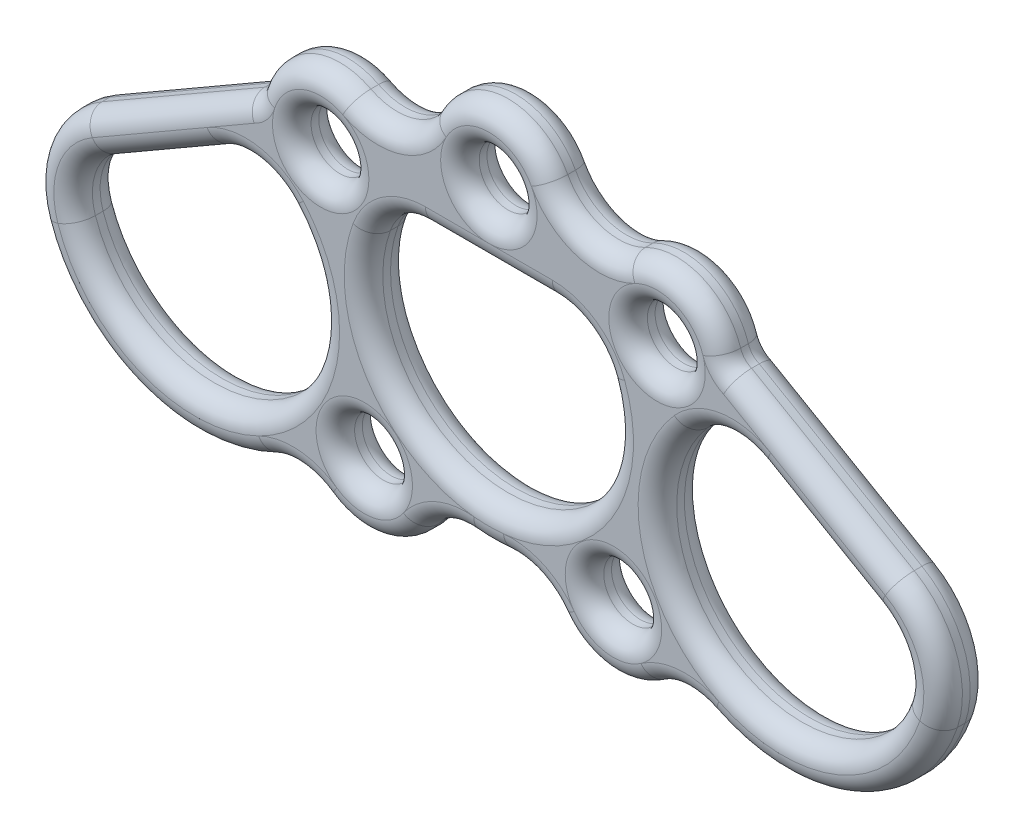
from build123d import *

# Parameters (mm, degrees)
SKETCH1_R           = 7.5
BOSS_EXTRUDE1_DEPTH = 12
FILLET1_R           = 15
FILLET2_R           = 5
FILLET3_R           = 25
FILLET4_R           = 5


# Some blends are built 0.0001 mm under size
with BuildPart() as part:
    # Sketch1 → Boss-Extrude1 (new body)
    # profile 1 of 48: a face of its own
    with BuildSketch(Plane.XY):
        with BuildLine():
            ThreePointArc((-41.84595656, 7.42737636), (-55.869601622, 12.360993525), (-61.038973343, 26.299458116))
            ThreePointArc((-61.038973343, 26.299458116), (-62.068625864, 26.67748335), (-63.107690857, 27.028811305))
            Line((-63.107690857, 27.028811305), (-117.762309143, -4.526047275))
            ThreePointArc((-117.762309143, -4.526047275), (-102.335797051, -46.918091439), (-57.462649505, -51.550942944))
            ThreePointArc((-57.462649505, -51.550942944), (-52.67515042, -48.799720421), (-48.28474914, -45.451026727))
            ThreePointArc((-48.28474914, -45.451026727), (-48.072383408, -30.746296685), (-36.72153812, -21.395762152))
            ThreePointArc((-36.72153812, -21.395762152), (-41.843830292, -7.439345838), (-41.84595656, 7.42737636))
        make_face()
        with BuildLine():
            Line((-108.593839025, -10.779633968), (-62.276160975, 15.961889923))
            ThreePointArc((-62.276160975, 15.961889923), (-59.95, -41.550186854), (-108.593839025, -10.779633968))
        make_face(mode=Mode.SUBTRACT)
    # profile 2 of 48: a face of its own
    with BuildSketch(Plane.XY):
        with BuildLine():
            ThreePointArc((-41.84595656, 7.42737636), (-41.528378124, 9.035696454), (-41.149008919, 10.630572184))
            ThreePointArc((-41.149008919, 10.630572184), (-49.899996618, 19.980662689), (-61.038973343, 26.299458116))
            ThreePointArc((-61.038973343, 26.299458116), (-55.869601622, 12.360993525), (-41.84595656, 7.42737636))
        make_face()
    # profile 3 of 48: a face of its own
    with BuildSketch(Plane.XY):
        with BuildLine():
            ThreePointArc((-39.397249674, 7.851404303), (-40.24626609, 9.257920603), (-41.149008919, 10.630572184))
            ThreePointArc((-41.149008919, 10.630572184), (-41.528378124, 9.035696454), (-41.84595656, 7.42737636))
            ThreePointArc((-41.84595656, 7.42737636), (-40.614066659, 7.595868255), (-39.397249674, 7.851404303))
        make_face()
    # profile 4 of 48: a face of its own
    with BuildSketch(Plane.XY):
        with BuildLine():
            Line((-29.07318352, 31), (-27.220282201, 31))
            ThreePointArc((-27.220282201, 31), (-30.528462766, 36.474751978), (-35.583084699, 40.39492608))
            ThreePointArc((-35.583084699, 40.39492608), (-52.077284277, 40.148908412), (-61.038973343, 26.299458116))
            ThreePointArc((-61.038973343, 26.299458116), (-49.899996618, 19.980662689), (-41.149008919, 10.630572184))
            ThreePointArc((-41.149008919, 10.630572184), (-36.558411825, 21.673313657), (-29.07318352, 31))
        make_face()
        with Locations((-43.6, 24.839249655)):
            Circle(SKETCH1_R, mode=Mode.SUBTRACT)
    # profile 5 of 48: a face of its own
    with BuildSketch(Plane.XY):
        with BuildLine():
            ThreePointArc((-26.1, 24.839249655), (-26.38234828, 27.970139186), (-27.220282201, 31))
            Line((-27.220282201, 31), (-29.07318352, 31))
            ThreePointArc((-29.07318352, 31), (-36.558411825, 21.673313657), (-41.149008919, 10.630572184))
            ThreePointArc((-41.149008919, 10.630572184), (-40.24626609, 9.257920603), (-39.397249674, 7.851404303))
            ThreePointArc((-39.397249674, 7.851404303), (-29.819613019, 14.052640612), (-26.1, 24.839249655))
        make_face()
    # profile 6 of 48: a face of its own
    with BuildSketch(Plane.XY):
        with BuildLine():
            ThreePointArc((-41.84595656, 7.42737636), (-41.528378124, 9.035696454), (-41.149008919, 10.630572184))
            ThreePointArc((-41.149008919, 10.630572184), (-49.899996618, 19.980662689), (-61.038973343, 26.299458116))
            ThreePointArc((-61.038973343, 26.299458116), (-55.869601622, 12.360993525), (-41.84595656, 7.42737636))
        make_face()
    # profile 7 of 48: a face of its own
    with BuildSketch(Plane.XY):
        with BuildLine():
            ThreePointArc((-39.397249674, 7.851404303), (-40.24626609, 9.257920603), (-41.149008919, 10.630572184))
            ThreePointArc((-41.149008919, 10.630572184), (-41.528378124, 9.035696454), (-41.84595656, 7.42737636))
            ThreePointArc((-41.84595656, 7.42737636), (-40.614066659, 7.595868255), (-39.397249674, 7.851404303))
        make_face()
    # profile 8 of 48: a face of its own
    with BuildSketch(Plane.XY):
        with BuildLine():
            ThreePointArc((-34.375475542, -20.951490082), (-34.331589877, -6.104619195), (-39.397249674, 7.851404303))
            ThreePointArc((-39.397249674, 7.851404303), (-40.614066659, 7.595868255), (-41.84595656, 7.42737636))
            ThreePointArc((-41.84595656, 7.42737636), (-41.843830292, -7.439345838), (-36.72153812, -21.395762152))
            ThreePointArc((-36.72153812, -21.395762152), (-35.556092912, -21.133566385), (-34.375475542, -20.951490082))
        make_face()
    # profile 9 of 48: a face of its own
    with BuildSketch(Plane.XY):
        with BuildLine():
            ThreePointArc((15.811388301, 31), (9.354143472, 23.709800545), (1.2e-08, 21))
            ThreePointArc((1.2e-08, 21), (-9.354143462, 23.709800539), (-15.811388301, 31))
            Line((-15.811388301, 31), (-27.220282201, 31))
            ThreePointArc((-27.220282201, 31), (-26.38234828, 27.970139186), (-26.1, 24.839249655))
            ThreePointArc((-26.1, 24.839249655), (-29.819613019, 14.052640612), (-39.397249674, 7.851404303))
            ThreePointArc((-39.397249674, 7.851404303), (-34.331589877, -6.104619195), (-34.375475542, -20.951490082))
            ThreePointArc((-34.375475542, -20.951490082), (-20.682573908, -25.240374739), (-14.8, -38.327979982))
            ThreePointArc((-14.8, -38.327979982), (-14.815855806, -39.072763051), (-14.863394494, -39.816196505))
            ThreePointArc((-14.863394494, -39.816196505), (-9.669633673, -41.385361961), (-4.318281611, -42.280047823))
            ThreePointArc((-4.318281611, -42.280047823), (0, -42.5), (4.318281611, -42.280047823))
            ThreePointArc((4.318281611, -42.280047823), (9.669633673, -41.385361961), (14.863394494, -39.816196505))
            ThreePointArc((14.863394494, -39.816196505), (20.136104014, -25.746659128), (34.375475542, -20.951490082))
            ThreePointArc((34.375475542, -20.951490082), (34.331589877, -6.104619195), (39.397249674, 7.851404303))
            ThreePointArc((39.397249674, 7.851404303), (28.112138003, 16.692094889), (27.220282201, 31))
            Line((27.220282201, 31), (15.811388301, 31))
        make_face()
        with BuildLine():
            ThreePointArc((24.80423351, 21), (0, -32.5), (-24.80423351, 21))
            Line((-24.80423351, 21), (1.2e-08, 21))
            Line((1.2e-08, 21), (24.80423351, 21))
        make_face(mode=Mode.SUBTRACT)
    # profile 10 of 48: a face of its own
    with BuildSketch(Plane.XY):
        with BuildLine():
            ThreePointArc((-14.8, -38.327979982), (-20.682573908, -25.240374739), (-34.375475542, -20.951490082))
            ThreePointArc((-34.375475542, -20.951490082), (-34.684596642, -22.499485421), (-35.050991081, -24.034933415))
            ThreePointArc((-35.050991081, -24.034933415), (-26.174864622, -33.483226577), (-14.863394494, -39.816196505))
            ThreePointArc((-14.863394494, -39.816196505), (-14.815855806, -39.072763051), (-14.8, -38.327979982))
        make_face()
    # profile 11 of 48: a face of its own
    with BuildSketch(Plane.XY):
        with BuildLine():
            ThreePointArc((-35.050991081, -24.034933415), (-34.684596642, -22.499485421), (-34.375475542, -20.951490082))
            ThreePointArc((-34.375475542, -20.951490082), (-35.556092912, -21.133566385), (-36.72153812, -21.395762152))
            ThreePointArc((-36.72153812, -21.395762152), (-35.910517863, -22.730699654), (-35.050991081, -24.034933415))
        make_face()
    # profile 12 of 48: a face of its own
    with BuildSketch(Plane.XY):
        with BuildLine():
            ThreePointArc((-35.050991081, -24.034933415), (-35.910517863, -22.730699654), (-36.72153812, -21.395762152))
            ThreePointArc((-36.72153812, -21.395762152), (-48.072383408, -30.746296685), (-48.28474914, -45.451026727))
            ThreePointArc((-48.28474914, -45.451026727), (-40.045743572, -35.74534917), (-35.050991081, -24.034933415))
        make_face()
    # profile 13 of 48: a face of its own
    with BuildSketch(Plane.XY):
        with BuildLine():
            ThreePointArc((-14.8, -38.327979982), (-20.682573908, -25.240374739), (-34.375475542, -20.951490082))
            ThreePointArc((-34.375475542, -20.951490082), (-34.684596642, -22.499485421), (-35.050991081, -24.034933415))
            ThreePointArc((-35.050991081, -24.034933415), (-26.174864622, -33.483226577), (-14.863394494, -39.816196505))
            ThreePointArc((-14.863394494, -39.816196505), (-14.815855806, -39.072763051), (-14.8, -38.327979982))
        make_face()
    # profile 14 of 48: a face of its own
    with BuildSketch(Plane.XY):
        with BuildLine():
            ThreePointArc((-35.050991081, -24.034933415), (-34.684596642, -22.499485421), (-34.375475542, -20.951490082))
            ThreePointArc((-34.375475542, -20.951490082), (-35.556092912, -21.133566385), (-36.72153812, -21.395762152))
            ThreePointArc((-36.72153812, -21.395762152), (-35.910517863, -22.730699654), (-35.050991081, -24.034933415))
        make_face()
    # profile 15 of 48: a face of its own
    with BuildSketch(Plane.XY):
        with BuildLine():
            ThreePointArc((-35.050991081, -24.034933415), (-35.910517863, -22.730699654), (-36.72153812, -21.395762152))
            ThreePointArc((-36.72153812, -21.395762152), (-48.072383408, -30.746296685), (-48.28474914, -45.451026727))
            ThreePointArc((-48.28474914, -45.451026727), (-40.045743572, -35.74534917), (-35.050991081, -24.034933415))
        make_face()
    # profile 16 of 48: a face of its own
    with BuildSketch(Plane.XY):
        with BuildLine():
            ThreePointArc((-14.8, -38.327979982), (-20.682573908, -25.240374739), (-34.375475542, -20.951490082))
            ThreePointArc((-34.375475542, -20.951490082), (-34.684596642, -22.499485421), (-35.050991081, -24.034933415))
            ThreePointArc((-35.050991081, -24.034933415), (-26.174864622, -33.483226577), (-14.863394494, -39.816196505))
            ThreePointArc((-14.863394494, -39.816196505), (-14.815855806, -39.072763051), (-14.8, -38.327979982))
        make_face()
    # profile 17 of 48: a face of its own
    with BuildSketch(Plane.XY):
        with BuildLine():
            ThreePointArc((-35.050991081, -24.034933415), (-34.684596642, -22.499485421), (-34.375475542, -20.951490082))
            ThreePointArc((-34.375475542, -20.951490082), (-35.556092912, -21.133566385), (-36.72153812, -21.395762152))
            ThreePointArc((-36.72153812, -21.395762152), (-35.910517863, -22.730699654), (-35.050991081, -24.034933415))
        make_face()
    # profile 18 of 48: a face of its own
    with BuildSketch(Plane.XY):
        with BuildLine():
            ThreePointArc((-35.050991081, -24.034933415), (-35.910517863, -22.730699654), (-36.72153812, -21.395762152))
            ThreePointArc((-36.72153812, -21.395762152), (-48.072383408, -30.746296685), (-48.28474914, -45.451026727))
            ThreePointArc((-48.28474914, -45.451026727), (-40.045743572, -35.74534917), (-35.050991081, -24.034933415))
        make_face()
    # profile 19 of 48: a face of its own
    with BuildSketch(Plane.XY):
        with BuildLine():
            ThreePointArc((-14.863394494, -39.816196505), (-26.174864622, -33.483226577), (-35.050991081, -24.034933415))
            ThreePointArc((-35.050991081, -24.034933415), (-40.045743572, -35.74534917), (-48.28474914, -45.451026727))
            ThreePointArc((-48.28474914, -45.451026727), (-45.782449562, -49.48475164), (-42.288174526, -52.697613577))
            ThreePointArc((-42.288174526, -52.697613577), (-29.307216931, -55.570173854), (-18.053589771, -48.491138723))
            ThreePointArc((-18.053589771, -48.491138723), (-15.875413943, -44.368093628), (-14.863394494, -39.816196505))
        make_face()
        with Locations((-32.3, -38.327979982)):
            Circle(SKETCH1_R, mode=Mode.SUBTRACT)
    # profile 20 of 48: a face of its own
    with BuildSketch(Plane.XY):
        with BuildLine():
            Line((-15.811388301, 31), (0, 31))
            Line((0, 31), (15.811388301, 31))
            ThreePointArc((15.811388301, 31), (17.072628609, 34.656127946), (17.5, 38.5))
            ThreePointArc((17.5, 38.5), (16.982345775, 42.724917983), (15.460007776, 46.699887778))
            ThreePointArc((15.460007776, 46.699887778), (0, 56), (-15.460007776, 46.699887778))
            ThreePointArc((-15.460007776, 46.699887778), (-17.495618657, 38.891570931), (-15.811388301, 31))
        make_face()
        with BuildLine():
            ThreePointArc((7.5, 38.5), (5.303300859, 33.196699141), (0, 31))
            ThreePointArc((0, 31), (-5.303300859, 43.803300859), (7.5, 38.5))
        make_face(mode=Mode.SUBTRACT)
    # profile 21 of 48: a face of its own
    with BuildSketch(Plane.XY):
        with BuildLine():
            ThreePointArc((-15.811388301, 31), (-9.354143462, 23.709800539), (1.2e-08, 21))
            Line((0, 21), (0, 31))
            Line((0, 31), (-15.811388301, 31))
        make_face()
    # profile 22 of 48: a face of its own
    with BuildSketch(Plane.XY):
        with BuildLine():
            Line((0, 31), (0, 21))
            ThreePointArc((1.2e-08, 21), (9.354143472, 23.709800545), (15.811388301, 31))
            Line((15.811388301, 31), (0, 31))
        make_face()
    # profile 23 of 48: a face of its own
    with BuildSketch(Plane.XY):
        with BuildLine():
            ThreePointArc((-15.811388301, 31), (-9.354143462, 23.709800539), (1.2e-08, 21))
            Line((0, 21), (0, 31))
            Line((0, 31), (-15.811388301, 31))
        make_face()
    # profile 24 of 48: a face of its own
    with BuildSketch(Plane.XY):
        with BuildLine():
            Line((0, 31), (0, 21))
            ThreePointArc((1.2e-08, 21), (9.354143472, 23.709800545), (15.811388301, 31))
            Line((15.811388301, 31), (0, 31))
        make_face()
    # profile 25 of 48: a face of its own
    with BuildSketch(Plane.XY):
        with BuildLine():
            ThreePointArc((35.583084699, 40.39492608), (30.528462766, 36.474751978), (27.220282201, 31))
            Line((27.220282201, 31), (29.07318352, 31))
            ThreePointArc((29.07318352, 31), (36.558411825, 21.673313657), (41.149008919, 10.630572184))
            ThreePointArc((41.149008919, 10.630572184), (49.899996618, 19.980662689), (61.038973343, 26.299458116))
            ThreePointArc((61.038973343, 26.299458116), (52.077284277, 40.148908412), (35.583084699, 40.39492608))
        make_face()
        with Locations((43.6, 24.839249655)):
            Circle(SKETCH1_R, mode=Mode.SUBTRACT)
    # profile 26 of 48: a face of its own
    with BuildSketch(Plane.XY):
        with BuildLine():
            Line((29.07318352, 31), (27.220282201, 31))
            ThreePointArc((27.220282201, 31), (28.112138003, 16.692094889), (39.397249674, 7.851404303))
            ThreePointArc((39.397249674, 7.851404303), (40.24626609, 9.257920603), (41.149008919, 10.630572184))
            ThreePointArc((41.149008919, 10.630572184), (36.558411825, 21.673313657), (29.07318352, 31))
        make_face()
    # profile 27 of 48: a face of its own
    with BuildSketch(Plane.XY):
        with BuildLine():
            ThreePointArc((41.149008919, 10.630572184), (40.24626609, 9.257920603), (39.397249674, 7.851404303))
            ThreePointArc((39.397249674, 7.851404303), (40.614066659, 7.595868255), (41.84595656, 7.42737636))
            ThreePointArc((41.84595656, 7.42737636), (41.528378124, 9.035696454), (41.149008919, 10.630572184))
        make_face()
    # profile 28 of 48: a face of its own
    with BuildSketch(Plane.XY):
        with BuildLine():
            ThreePointArc((61.038973343, 26.299458116), (49.899996618, 19.980662689), (41.149008919, 10.630572184))
            ThreePointArc((41.149008919, 10.630572184), (41.528378124, 9.035696454), (41.84595656, 7.42737636))
            ThreePointArc((41.84595656, 7.42737636), (55.337849884, 11.85953933), (61.1, 24.839249655))
            ThreePointArc((61.1, 24.839249655), (61.084736679, 25.569991231), (61.038973343, 26.299458116))
        make_face()
    # profile 29 of 48: a face of its own
    with BuildSketch(Plane.XY):
        with BuildLine():
            ThreePointArc((41.149008919, 10.630572184), (40.24626609, 9.257920603), (39.397249674, 7.851404303))
            ThreePointArc((39.397249674, 7.851404303), (40.614066659, 7.595868255), (41.84595656, 7.42737636))
            ThreePointArc((41.84595656, 7.42737636), (41.528378124, 9.035696454), (41.149008919, 10.630572184))
        make_face()
    # profile 30 of 48: a face of its own
    with BuildSketch(Plane.XY):
        with BuildLine():
            ThreePointArc((61.038973343, 26.299458116), (49.899996618, 19.980662689), (41.149008919, 10.630572184))
            ThreePointArc((41.149008919, 10.630572184), (41.528378124, 9.035696454), (41.84595656, 7.42737636))
            ThreePointArc((41.84595656, 7.42737636), (55.337849884, 11.85953933), (61.1, 24.839249655))
            ThreePointArc((61.1, 24.839249655), (61.084736679, 25.569991231), (61.038973343, 26.299458116))
        make_face()
    # profile 31 of 48: a face of its own
    with BuildSketch(Plane.XY):
        with BuildLine():
            ThreePointArc((41.84595656, 7.42737636), (40.614066659, 7.595868255), (39.397249674, 7.851404303))
            ThreePointArc((39.397249674, 7.851404303), (34.331589877, -6.104619195), (34.375475542, -20.951490082))
            ThreePointArc((34.375475542, -20.951490082), (35.556092912, -21.133566385), (36.72153812, -21.395762152))
            ThreePointArc((36.72153812, -21.395762152), (41.843830292, -7.439345838), (41.84595656, 7.42737636))
        make_face()
    # profile 32 of 48: a face of its own
    with BuildSketch(Plane.XY):
        with BuildLine():
            ThreePointArc((63.107690857, 27.028811305), (62.068625864, 26.67748335), (61.038973343, 26.299458116))
            ThreePointArc((61.038973343, 26.299458116), (61.084736679, 25.569991231), (61.1, 24.839249655))
            ThreePointArc((61.1, 24.839249655), (55.337849884, 11.85953933), (41.84595656, 7.42737636))
            ThreePointArc((41.84595656, 7.42737636), (41.843830292, -7.439345838), (36.72153812, -21.395762152))
            ThreePointArc((36.72153812, -21.395762152), (46.14967359, -27.630478337), (49.8, -38.327979982))
            ThreePointArc((49.8, -38.327979982), (49.416996085, -41.969194755), (48.28474914, -45.451026727))
            ThreePointArc((48.28474914, -45.451026727), (52.67515042, -48.799720421), (57.462649505, -51.550942944))
            ThreePointArc((57.462649505, -51.550942944), (102.335797051, -46.918091439), (117.762309143, -4.526047275))
            Line((117.762309143, -4.526047275), (63.107690857, 27.028811305))
        make_face()
        with BuildLine():
            ThreePointArc((108.593839025, -10.779633968), (59.95, -41.550186854), (62.276160975, 15.961889923))
            Line((62.276160975, 15.961889923), (108.593839025, -10.779633968))
        make_face(mode=Mode.SUBTRACT)
    # profile 33 of 48: a face of its own
    with BuildSketch(Plane.XY):
        with BuildLine():
            ThreePointArc((48.28474914, -45.451026727), (40.045743572, -35.74534917), (35.050991081, -24.034933415))
            ThreePointArc((35.050991081, -24.034933415), (26.174864622, -33.483226577), (14.863394494, -39.816196505))
            ThreePointArc((14.863394494, -39.816196505), (15.875413943, -44.368093628), (18.053589771, -48.491138723))
            ThreePointArc((18.053589771, -48.491138723), (29.307216931, -55.570173854), (42.288174526, -52.697613577))
            ThreePointArc((42.288174526, -52.697613577), (45.782449562, -49.48475164), (48.28474914, -45.451026727))
        make_face()
        with Locations((32.3, -38.327979982)):
            Circle(SKETCH1_R, mode=Mode.SUBTRACT)
    # profile 34 of 48: a face of its own
    with BuildSketch(Plane.XY):
        with BuildLine():
            ThreePointArc((36.72153812, -21.395762152), (35.556092912, -21.133566385), (34.375475542, -20.951490082))
            ThreePointArc((34.375475542, -20.951490082), (34.684596642, -22.499485421), (35.050991081, -24.034933415))
            ThreePointArc((35.050991081, -24.034933415), (35.910517863, -22.730699654), (36.72153812, -21.395762152))
        make_face()
    # profile 35 of 48: a face of its own
    with BuildSketch(Plane.XY):
        with BuildLine():
            ThreePointArc((35.050991081, -24.034933415), (34.684596642, -22.499485421), (34.375475542, -20.951490082))
            ThreePointArc((34.375475542, -20.951490082), (20.136104014, -25.746659128), (14.863394494, -39.816196505))
            ThreePointArc((14.863394494, -39.816196505), (26.174864622, -33.483226577), (35.050991081, -24.034933415))
        make_face()
    # profile 36 of 48: a face of its own
    with BuildSketch(Plane.XY):
        with BuildLine():
            ThreePointArc((36.72153812, -21.395762152), (35.910517863, -22.730699654), (35.050991081, -24.034933415))
            ThreePointArc((35.050991081, -24.034933415), (40.045743572, -35.74534917), (48.28474914, -45.451026727))
            ThreePointArc((48.28474914, -45.451026727), (49.416996085, -41.969194755), (49.8, -38.327979982))
            ThreePointArc((49.8, -38.327979982), (46.14967359, -27.630478337), (36.72153812, -21.395762152))
        make_face()
    # profile 37 of 48: a face of its own
    with BuildSketch(Plane.XY):
        with BuildLine():
            ThreePointArc((36.72153812, -21.395762152), (35.556092912, -21.133566385), (34.375475542, -20.951490082))
            ThreePointArc((34.375475542, -20.951490082), (34.684596642, -22.499485421), (35.050991081, -24.034933415))
            ThreePointArc((35.050991081, -24.034933415), (35.910517863, -22.730699654), (36.72153812, -21.395762152))
        make_face()
    # profile 38 of 48: a face of its own
    with BuildSketch(Plane.XY):
        with BuildLine():
            ThreePointArc((35.050991081, -24.034933415), (34.684596642, -22.499485421), (34.375475542, -20.951490082))
            ThreePointArc((34.375475542, -20.951490082), (20.136104014, -25.746659128), (14.863394494, -39.816196505))
            ThreePointArc((14.863394494, -39.816196505), (26.174864622, -33.483226577), (35.050991081, -24.034933415))
        make_face()
    # profile 39 of 48: a face of its own
    with BuildSketch(Plane.XY):
        with BuildLine():
            ThreePointArc((36.72153812, -21.395762152), (35.910517863, -22.730699654), (35.050991081, -24.034933415))
            ThreePointArc((35.050991081, -24.034933415), (40.045743572, -35.74534917), (48.28474914, -45.451026727))
            ThreePointArc((48.28474914, -45.451026727), (49.416996085, -41.969194755), (49.8, -38.327979982))
            ThreePointArc((49.8, -38.327979982), (46.14967359, -27.630478337), (36.72153812, -21.395762152))
        make_face()
    # profile 40 of 48: a face of its own
    with BuildSketch(Plane.XY):
        with BuildLine():
            ThreePointArc((36.72153812, -21.395762152), (35.556092912, -21.133566385), (34.375475542, -20.951490082))
            ThreePointArc((34.375475542, -20.951490082), (34.684596642, -22.499485421), (35.050991081, -24.034933415))
            ThreePointArc((35.050991081, -24.034933415), (35.910517863, -22.730699654), (36.72153812, -21.395762152))
        make_face()
    # profile 41 of 48: a face of its own
    with BuildSketch(Plane.XY):
        with BuildLine():
            ThreePointArc((35.050991081, -24.034933415), (34.684596642, -22.499485421), (34.375475542, -20.951490082))
            ThreePointArc((34.375475542, -20.951490082), (20.136104014, -25.746659128), (14.863394494, -39.816196505))
            ThreePointArc((14.863394494, -39.816196505), (26.174864622, -33.483226577), (35.050991081, -24.034933415))
        make_face()
    # profile 42 of 48: a face of its own
    with BuildSketch(Plane.XY):
        with BuildLine():
            ThreePointArc((36.72153812, -21.395762152), (35.910517863, -22.730699654), (35.050991081, -24.034933415))
            ThreePointArc((35.050991081, -24.034933415), (40.045743572, -35.74534917), (48.28474914, -45.451026727))
            ThreePointArc((48.28474914, -45.451026727), (49.416996085, -41.969194755), (49.8, -38.327979982))
            ThreePointArc((49.8, -38.327979982), (46.14967359, -27.630478337), (36.72153812, -21.395762152))
        make_face()
    # profile 43 of 48: a face of its own
    with BuildSketch(Plane.XY):
        with BuildLine():
            Line((-27.220282201, 31), (-15.811388301, 31))
            ThreePointArc((-15.811388301, 31), (-17.495618657, 38.891570931), (-15.460007776, 46.699887778))
            ThreePointArc((-15.460007776, 46.699887778), (-24.226626747, 39.414508781), (-35.583084699, 40.39492608))
            ThreePointArc((-35.583084699, 40.39492608), (-30.528462766, 36.474751978), (-27.220282201, 31))
        make_face()
    # profile 44 of 48: a face of its own
    with BuildSketch(Plane.XY):
        with BuildLine():
            ThreePointArc((17.5, 38.5), (17.072628609, 34.656127946), (15.811388301, 31))
            Line((15.811388301, 31), (27.220282201, 31))
            ThreePointArc((27.220282201, 31), (30.528462766, 36.474751978), (35.583084699, 40.39492608))
            ThreePointArc((35.583084699, 40.39492608), (24.226626747, 39.414508781), (15.460007776, 46.699887778))
            ThreePointArc((15.460007776, 46.699887778), (16.982345775, 42.724917983), (17.5, 38.5))
        make_face()
    # profile 45 of 48: a face of its own
    with BuildSketch(Plane.XY):
        with BuildLine():
            ThreePointArc((-42.288174526, -52.697613577), (-45.782449562, -49.48475164), (-48.28474914, -45.451026727))
            ThreePointArc((-48.28474914, -45.451026727), (-52.67515042, -48.799720421), (-57.462649505, -51.550942944))
            ThreePointArc((-57.462649505, -51.550942944), (-49.71920309, -50.057086204), (-42.288174526, -52.697613577))
        make_face()
    # profile 46 of 48: a face of its own
    with BuildSketch(Plane.XY):
        with BuildLine():
            ThreePointArc((-4.318281611, -42.280047823), (-9.669633673, -41.385361961), (-14.863394494, -39.816196505))
            ThreePointArc((-14.863394494, -39.816196505), (-15.875413943, -44.368093628), (-18.053589771, -48.491138723))
            ThreePointArc((-18.053589771, -48.491138723), (-12.022833191, -43.534864433), (-4.318281611, -42.280047823))
        make_face()
    # profile 47 of 48: a face of its own
    with BuildSketch(Plane.XY):
        with BuildLine():
            ThreePointArc((18.053589771, -48.491138723), (15.875413943, -44.368093628), (14.863394494, -39.816196505))
            ThreePointArc((14.863394494, -39.816196505), (9.669633673, -41.385361961), (4.318281611, -42.280047823))
            ThreePointArc((4.318281611, -42.280047823), (12.022833191, -43.534864433), (18.053589771, -48.491138723))
        make_face()
    # profile 48 of 48: a face of its own
    with BuildSketch(Plane.XY):
        with BuildLine():
            ThreePointArc((57.462649505, -51.550942944), (52.67515042, -48.799720421), (48.28474914, -45.451026727))
            ThreePointArc((48.28474914, -45.451026727), (45.782449562, -49.48475164), (42.288174526, -52.697613577))
            ThreePointArc((42.288174526, -52.697613577), (49.71920309, -50.057086204), (57.462649505, -51.550942944))
        make_face()
    extrude(amount=BOSS_EXTRUDE1_DEPTH)

    # Fillet1
    fillet1_edges = [part.edges().sort_by_distance(p)[0] for p in [
        (62.276160975, 15.961889923, 6),
        (108.593839025, -10.779633968, 6),
        (-62.276160975, 15.961889923, 6),
        (-108.593839025, -10.779633968, 6),
        (-24.80423351, 21, 6),
        (24.80423351, 21, 6),
    ]]
    fillet(fillet1_edges, radius=FILLET1_R)

    # Fillet2
    # the kernel refuses this fillet: 5 mm, written as the material it adds along each edge
    with BuildSketch(Plane(origin=(-61.038973343, 26.299458116, 0), x_dir=(0.19398331972132607, 0.9810048275466813, 0), z_dir=(0, 0, 1))) as fillet2_piece_1:
        with BuildLine():
            CenterArc((4.458053467, 4.968849463), FILLET2_R, 214.027382467, 49.573632004)
            Line((0.314202309, 2.170904221), (0.231325285, 2.114945316))
            ThreePointArc((0.231325285, 2.114945316), (0.07214038, 1.097748771), (-0.098566176, 0.016873322))
            Line((-0.098566176, 0.016873322), (0.011145134, -0.099376989))
            ThreePointArc((0.011145134, -0.099376989), (1.950398392, 0.009026878), (3.88965165, -0.099376989))
            Line((3.88965165, -0.099376989), (3.900796784, 0))
        make_face()
    extrude(amount=12)
    with BuildSketch(Plane(origin=(61.038973343, 26.299458116, 0), x_dir=(0.9431022254367292, 0.33250292085377087, 0), z_dir=(0, 0, 1))) as fillet2_piece_2:
        with BuildLine():
            CenterArc((5.556185431, 3.700339059), FILLET2_R, 178.163560419, 49.573632004)
            Line((0.558753525, 3.860571207), (0.458804887, 3.86377585))
            ThreePointArc((0.458804887, 3.86377585), (0.288310555, 1.928992586), (-0.096755761, 0.02526505))
            Line((-0.096755761, 0.02526505), (0.002580617, -0.099966697))
            ThreePointArc((0.002580617, -0.099966697), (1.096762079, -0.085846031), (2.126270932, -0.074006781))
            Line((2.126270932, -0.074006781), (2.193524157, 0))
        make_face()
    extrude(amount=12)

    # Fillet3
    fillet3_edges = [part.edges().sort_by_distance(p)[0] for p in [
        (-117.762309143, -4.526047275, 6),
        (117.762309143, -4.526047275, 6),
    ]]
    fillet(fillet3_edges, radius=FILLET3_R)

    # Fillet4
    fillet4_edges = [part.edges().sort_by_distance(p)[0] for p in [
        (-59.95, -41.550186854, 12),
        (106.819482286, -13.668895411, 0),
        (-39.8, -38.327979982, 12),
        (106.819482286, -13.668895411, 12),
        (60.661165537, 12.980621189, 0),
        (-51.1, 24.839249655, 12),
        (60.661165537, 12.980621189, 12),
        (-25.037454786, 18.291111771, 0),
        (36.1, 24.839249655, 12),
        (-25.037454786, 18.291111771, 12),
        (-106.819482286, -13.668895411, 0),
        (-106.819482286, -13.668895411, 12),
        (25.037454786, 18.291111771, 0),
        (25.037454786, 18.291111771, 12),
        (-60.661165537, 12.980621189, 0),
        (29.307216931, -55.570173854, 12),
        (-60.661165537, 12.980621189, 12),
        (24.8, -38.327979982, 12),
        (-61.354676148, 28.267052324, 0),
        (49.71920309, -50.057086204, 12),
        (-61.354676148, 28.267052324, 12),
        (61.354676148, 28.267052324, 0),
        (61.354676148, 28.267052324, 12),
        (-92.558831189, -52.629845831, 0),
        (92.558831189, -52.629845831, 0),
        (-116.172789117, -10.131148767, 0),
        (116.172789117, -10.131148767, 0),
        (92.558831189, -52.629845831, 12),
        (-92.558831189, -52.629845831, 12),
        (-116.172789117, -10.131148767, 12),
        (116.172789117, -10.131148767, 12),
        (84.198606448, 14.851965511, 12),
        (24.8, -38.327979982, 0),
        (50.318187954, 40.998332259, 12),
        (36.1, 24.839249655, 0),
        (-51.1, 24.839249655, 0),
        (-39.8, -38.327979982, 0),
        (-7.5, 38.5, 0),
        (24.226626747, 39.414508781, 12),
        (12.022833191, -43.534864433, 0),
        (0, -42.5, 0),
        (-12.022833191, -43.534864433, 0),
        (-29.307216931, -55.570173854, 0),
        (-49.71920309, -50.057086204, 0),
        (-84.198606448, 14.851965511, 0),
        (0, 56, 12),
        (-50.318187954, 40.998332259, 0),
        (-24.226626747, 39.414508781, 0),
        (0, 56, 0),
        (24.226626747, 39.414508781, 0),
        (50.318187954, 40.998332259, 0),
        (84.198606448, 14.851965511, 0),
        (-24.226626747, 39.414508781, 12),
        (49.71920309, -50.057086204, 0),
        (29.307216931, -55.570173854, 0),
        (-50.318187954, 40.998332259, 12),
        (-84.198606448, 14.851965511, 12),
        (-49.71920309, -50.057086204, 12),
        (-29.307216931, -55.570173854, 12),
        (-12.022833191, -43.534864433, 12),
        (0, -42.5, 12),
        (12.022833191, -43.534864433, 12),
        (-7.5, 38.5, 12),
        (59.95, -41.550186854, 0),
        (59.95, -41.550186854, 12),
        (85.435, 2.591127977, 0),
        (85.435, 2.591127977, 12),
        (0, 21, 0),
        (0, 21, 12),
        (0, -32.5, 0),
        (0, -32.5, 12),
        (-85.435, 2.591127977, 0),
        (-85.435, 2.591127977, 12),
        (-59.95, -41.550186854, 0),
    ]]
    fillet(fillet4_edges, radius=FILLET4_R - 0.0001)  # a hair under: the kernel refuses the full size


solid = part.part
